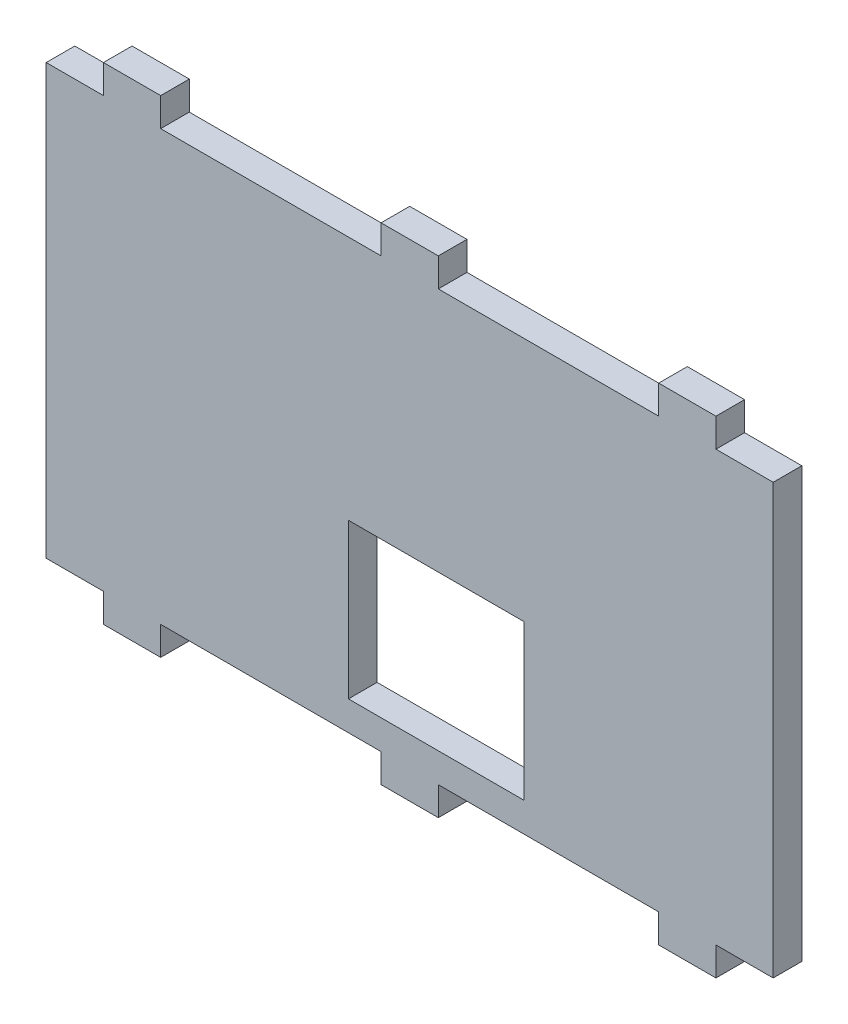
from build123d import *

# Parameters (mm, degrees)
ESQUISSE1_W             = 127
ESQUISSE1_H             = 75
BOSS_EXTRU_1_DEPTH      = 5
ESQUISSE2_W             = 10
ESQUISSE2_H             = 5
BOSS_EXTRU_2_DEPTH      = 5
ESQUISSE3_W             = 30.690062744
ESQUISSE3_H             = 27.024811689
ENL_V_MAT_EXTRU_1_DEPTH = 5


with BuildPart() as part:
    # Esquisse1 → Boss.-Extru.1 (new body)
    with BuildSketch(Plane.XY):
        with Locations((63.5, 37.5)):
            Rectangle(ESQUISSE1_W, ESQUISSE1_H)
    extrude(amount=BOSS_EXTRU_1_DEPTH)

    # Esquisse2 → Boss.-Extru.2 (add)
    with BuildSketch(Plane.XY.offset(5)):
        with Locations((15, 77.5)):
            Rectangle(ESQUISSE2_W, ESQUISSE2_H)
        with Locations((112, 77.5)):
            Rectangle(ESQUISSE2_W, ESQUISSE2_H)
        with Locations((63.5, 77.5)):
            Rectangle(ESQUISSE2_W, ESQUISSE2_H)
        with Locations((15, -2.5)):
            Rectangle(ESQUISSE2_W, ESQUISSE2_H)
        with Locations((63.5, -2.5)):
            Rectangle(ESQUISSE2_W, ESQUISSE2_H)
        with Locations((112, -2.5)):
            Rectangle(ESQUISSE2_W, ESQUISSE2_H)
    extrude(amount=-BOSS_EXTRU_2_DEPTH)

    # Esquisse3 → Enlèv. mat.-Extru.1 (cut)
    with BuildSketch(Plane(origin=(0, 0, 0), x_dir=(-1, 0, 0), z_dir=(0, 0, -1))):
        with Locations((-68.142098376, 18.636781697)):
            Rectangle(ESQUISSE3_W, ESQUISSE3_H)
    extrude(amount=-ENL_V_MAT_EXTRU_1_DEPTH, mode=Mode.SUBTRACT)


solid = part.part
